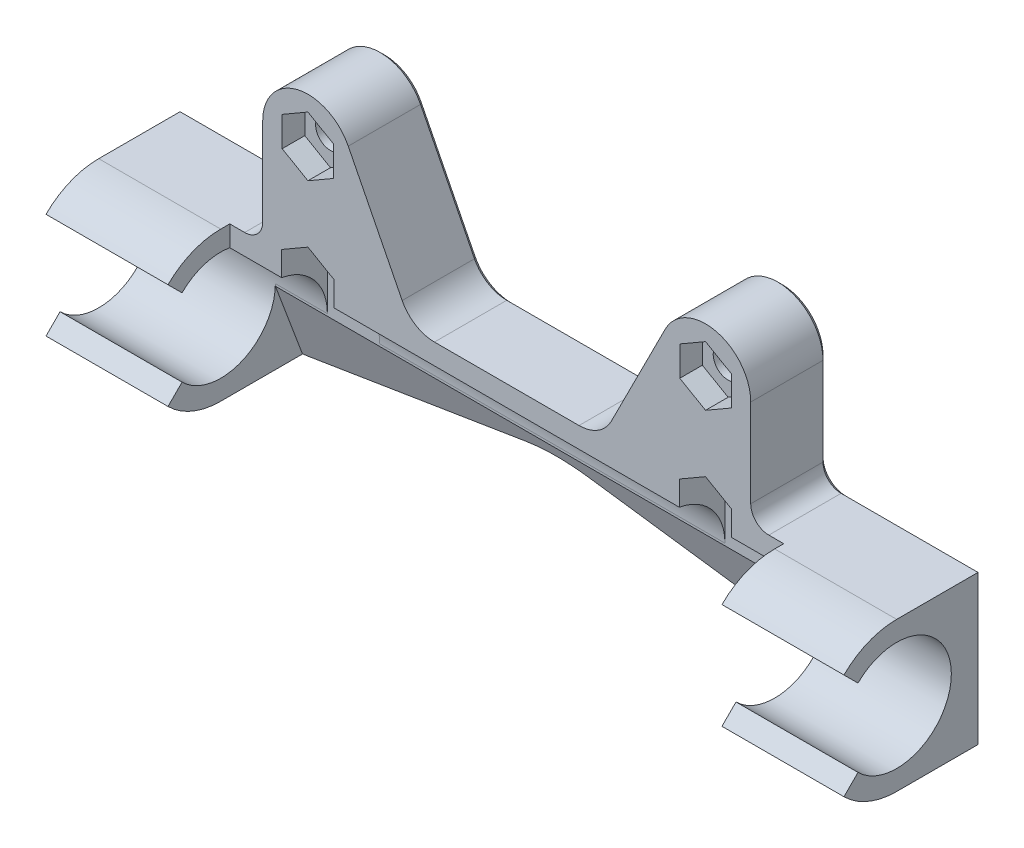
from build123d import *

# Parameters (mm, degrees)
BOSS_EXTRUDE1_DEPTH = 88.3
SKETCH6_R           = 1.65
BOSS_EXTRUDE2_DEPTH = 8.5
CUT_EXTRUDE1_DEPTH  = 93.261259475
SKETCH8_W           = 61.3
SKETCH8_H           = 21.483950942
CUT_EXTRUDE2_DEPTH  = 93.163658782
SKETCH9_W           = 61.3
SKETCH9_H           = 11.699409457
CUT_EXTRUDE3_DEPTH  = 93.53707735
SKETCH10_R          = 1.65
CUT_EXTRUDE4_DEPTH  = 94.043055829
CHAMFER1_SIZE       = 8
CHAMFER1_SIZE2      = 3
CUT_EXTRUDE5_DEPTH  = 93.537077445
FILLET1_R           = 2
CUT_EXTRUDE7_START  = -5.05
CUT_EXTRUDE7_DEPTH  = 5.05
CUT_EXTRUDE8_DEPTH  = 2.5
CHAMFER2_SIZE       = 0.5


with BuildPart() as part:
    # Sketch1 → Boss-Extrude1 (new body)
    with BuildSketch(Plane.ZY):
        with BuildLine():
            Line((-9.5, 8.25), (-9.5, -8.25))
            Line((-9.5, -8.25), (0, -8.25))
            ThreePointArc((0, -8.25), (8.25, 0), (0, 8.25))
            Line((0, 8.25), (-9.5, 8.25))
        make_face()
    extrude(amount=BOSS_EXTRUDE1_DEPTH)

    # Sketch6 → Boss-Extrude2 (add)
    with BuildSketch(Plane(origin=(0, 0, -9.5), x_dir=(-1, 0, 0), z_dir=(0, 0, -1))):
        with BuildLine():
            Line((17.15, -8.25), (17.15, 20))
            ThreePointArc((17.15, 20), (20.99096395, 24.863808737), (26.612654174, 22.254931867))
            Line((26.612654174, 22.254931867), (32.579554775, 10.446054507))
            ThreePointArc((32.579554775, 10.446054507), (34.053942202, 8.842964487), (36.149678114, 8.25))
            Line((36.149678114, 8.25), (52.150321886, 8.25))
            ThreePointArc((52.150321886, 8.25), (54.246057798, 8.842964487), (55.720445225, 10.446054507))
            Line((55.720445225, 10.446054507), (61.687345826, 22.254931867))
            ThreePointArc((61.687345826, 22.254931867), (67.30903605, 24.863808737), (71.15, 20))
            Line((71.15, 20), (71.15, -8.25))
            Line((71.15, -8.25), (17.15, -8.25))
        make_face()
        with Locations((22.15, 20)):
            Circle(SKETCH6_R, mode=Mode.SUBTRACT)
        with Locations(Location((66.15, 20, 0), (0, 0, 180))):
            Circle(SKETCH6_R, mode=Mode.SUBTRACT)
    extrude(amount=-BOSS_EXTRUDE2_DEPTH)

    # Sketch7 → Cut-Extrude1 (cut, through all)
    with BuildSketch(Plane.ZY.offset(88.3)):
        with BuildLine():
            Line((13.481907846, 13.481907846), (4.277996026, 4.277996026))
            ThreePointArc((4.277996026, 4.277996026), (-6.05, 0), (4.277996026, -4.277996026))
            Line((4.277996026, -4.277996026), (13.481907846, -13.481907846))
            Line((13.481907846, -13.481907846), (13.481907846, 13.481907846))
        make_face()
    extrude(amount=-CUT_EXTRUDE1_DEPTH, mode=Mode.SUBTRACT)

    # Sketch8 → Cut-Extrude2 (cut, through all)
    with BuildSketch(Plane.XY.offset(-1)):
        with Locations((-44.15, -2.491975471)):
            Rectangle(SKETCH8_W, SKETCH8_H)
    extrude(amount=CUT_EXTRUDE2_DEPTH, mode=Mode.SUBTRACT)

    # Sketch9 → Cut-Extrude3 (cut, through all)
    with BuildSketch(Plane(origin=(0, 0, -6.05), x_dir=(-1, 0, 0), z_dir=(0, 0, -1))):
        with Locations((44.15, -5.849704729)):
            Rectangle(SKETCH9_W, SKETCH9_H)
    extrude(amount=-CUT_EXTRUDE3_DEPTH, mode=Mode.SUBTRACT)

    # Sketch10 → Cut-Extrude4 (cut, through all)
    with BuildSketch(Plane(origin=(0, 0, -9.5), x_dir=(-1, 0, 0), z_dir=(0, 0, -1))):
        with Locations((22.15, 7)):
            Circle(SKETCH10_R)
        with Locations((66.15, 7)):
            Circle(SKETCH10_R)
    extrude(amount=-CUT_EXTRUDE4_DEPTH, mode=Mode.SUBTRACT)

    # Chamfer1
    chamfer1_edges = [part.edges().sort_by_distance(p)[0] for p in [
        (-44.15, -8.25, -6.05),
    ]]
    chamfer1_side = [part.faces().sort_by_distance(p)[0] for p in [
        (-44.15, -4.125, -6.05),
    ]]
    chamfer(chamfer1_edges, length=CHAMFER1_SIZE, length2=CHAMFER1_SIZE2, reference=chamfer1_side[0])

    # Sketch11 → Cut-Extrude5 (cut, through all)
    with BuildSketch(Plane(origin=(0, 0, -6.05), x_dir=(-1, 0, 0), z_dir=(0, 0, -1))):
        with BuildLine():
            Line((74.8, -8.25), (47.5958626, -1.828822614))
            ThreePointArc((47.5958626, -1.828822614), (44.15, -1.427659244), (40.7041374, -1.828822614))
            Line((40.7041374, -1.828822614), (13.5, -8.25))
            Line((13.5, -8.25), (13.5, -16.427659244))
            Line((13.5, -16.427659244), (74.8, -16.427659244))
            Line((74.8, -16.427659244), (74.8, -8.25))
        make_face()
    extrude(amount=CUT_EXTRUDE5_DEPTH, mode=Mode.SUBTRACT)

    # Fillet1
    fillet1_edges = [part.edges().sort_by_distance(p)[0] for p in [
        (-17.15, 8.25, -5.25),
        (-71.15, 8.25, -5.25),
    ]]
    fillet(fillet1_edges, radius=FILLET1_R)

    # Sketch13 → Cut-Extrude7 (cut)
    with BuildSketch(Plane.XY.offset(-1).offset(CUT_EXTRUDE7_START)):
        Polygon((-69.05, -2.12397244), (-63.25, -2.12397244), (-63.25, 8.674315781), (-66.15, 10.348631561), (-69.05, 8.674315781), align=None)
        Polygon((-25.05, -2.12397244), (-19.25, -2.12397244), (-19.25, 8.674315781), (-22.15, 10.348631561), (-25.05, 8.674315781), align=None)
    extrude(amount=CUT_EXTRUDE7_DEPTH, mode=Mode.SUBTRACT)

    # Sketch14 → Cut-Extrude8 (cut)
    with BuildSketch(Plane.XY.offset(-1)):
        Polygon((-69, 21.645448267), (-69, 18.354551733), (-66.15, 16.709103466), (-63.3, 18.354551733), (-63.3, 21.645448267), (-66.15, 23.290896534), align=None)
        Polygon((-22.15, 23.290896534), (-25, 21.645448267), (-25, 18.354551733), (-22.15, 16.709103466), (-19.3, 18.354551733), (-19.3, 21.645448267), align=None)
    extrude(amount=-CUT_EXTRUDE8_DEPTH, mode=Mode.SUBTRACT)

    # Chamfer2
    # the kernel refuses this chamfer: 0.5 mm, written as the material it takes off along each edge
    with BuildSketch(Plane(origin=(-88.3, 9.535841494, -9.5), x_dir=(0.9996219169112968, 0, -0.02749587661058574), z_dir=(0, -1, 0))) as chamfer2_piece_1:
        Polygon((CHAMFER2_SIZE * 0.999621916911, CHAMFER2_SIZE * 0.0274958766106), (-CHAMFER2_SIZE * 0.0274958766106, CHAMFER2_SIZE * 0.999621916911), (0, 0), align=None)
    extrude(amount=19.071682988, mode=Mode.SUBTRACT)
    with BuildSketch(Plane(origin=(-22.15, 7, -9.5), x_dir=(-1, 0, 0), z_dir=(0, -1, 0))) as chamfer2_piece_2:
        Polygon((1.65 + CHAMFER2_SIZE, 0), (1.65, -CHAMFER2_SIZE), (1.65, 0), align=None)
    revolve(axis=Axis((-22.15, 7, -9.5), (0, 0, -1)), mode=Mode.SUBTRACT)
    with BuildSketch(Plane(origin=(-66.15, 7, -9.5), x_dir=(-1, 0, 0), z_dir=(0, -1, 0))) as chamfer2_piece_3:
        Polygon((1.65 + CHAMFER2_SIZE, 0), (1.65, -CHAMFER2_SIZE), (1.65, 0), align=None)
    revolve(axis=Axis((-66.15, 7, -9.5), (0, 0, -1)), mode=Mode.SUBTRACT)
    with BuildSketch(Plane(origin=(-36.149678114, 8.25, -9.5), x_dir=(0, -0.9996219169112968, -0.027495876610585647), z_dir=(-1, 0, 0))) as chamfer2_piece_4:
        Polygon((CHAMFER2_SIZE * 0.999621916911, CHAMFER2_SIZE * 0.0274958766106), (-CHAMFER2_SIZE * 0.0274958766106, CHAMFER2_SIZE * 0.999621916911), (0, 0), align=None)
    extrude(amount=16.000643772, mode=Mode.SUBTRACT)
    with BuildSketch(Plane(origin=(1.285841494, -8.25, -9.5), x_dir=(0, 0.9996219169112968, -0.027495876610585647), z_dir=(-1, 0, 0)), Plane(origin=(-73.514158506, -8.25, -9.5), x_dir=(0, 0.9996219169112968, -0.027495876610585647), z_dir=(-1, 0, 0))) as chamfer2_piece_5:
        Polygon((CHAMFER2_SIZE * 0.999621916911, -CHAMFER2_SIZE * 0.0274958766106), (-CHAMFER2_SIZE * 0.0274958766106, -CHAMFER2_SIZE * 0.999621916911), (0, 0), align=None)
    extrude(amount=16.071682988, mode=Mode.SUBTRACT)
    with BuildSketch(Plane(origin=(-76.05145266, -8.545388874, -9.5), x_dir=(-0.22963731849575525, 0.9728878037695274, -0.027495876610585463), z_dir=(0.9732557753191584, 0.22972417332075415, 0)), Plane(origin=(-40.7041374, -1.828822614, -9.5), x_dir=(0.22963731849575528, 0.9728878037695274, -0.027495876610585706), z_dir=(0.9732557753191584, -0.2297241733207542, 0))) as chamfer2_piece_6:
        Polygon((CHAMFER2_SIZE * 0.999621916911, CHAMFER2_SIZE * 0.0274958766106), (-CHAMFER2_SIZE * 0.0274958766106, CHAMFER2_SIZE * 0.999621916911), (0, 0), align=None)
    extrude(amount=29.237524998, mode=Mode.SUBTRACT)
    with BuildSketch(Plane(origin=(-44.15, -16.427659244, -9.5), x_dir=(0.22972417332075398, 0.9732557753191584, 0), z_dir=(0.9732557753191584, -0.22972417332075398, 0))) as chamfer2_piece_7:
        Polygon((15 + CHAMFER2_SIZE, 0), (15, CHAMFER2_SIZE), (15, 0), align=None)
    revolve(axis=Axis((-44.15, -16.427659244, -9.5), (0, 0, 1)), revolution_arc=26.561666454, mode=Mode.SUBTRACT)
    with BuildSketch(Plane(origin=(-71.15, 20, -9.5), x_dir=(0.9996219169112968, 0, -0.02749587661058574), z_dir=(0, -1, 0)), Plane(origin=(-17.15, 10.25, -9.5), x_dir=(-0.9996219169112968, 0, -0.02749587661058555), z_dir=(0, 1, 0))) as chamfer2_piece_8:
        Polygon((CHAMFER2_SIZE * 0.999621916911, CHAMFER2_SIZE * 0.0274958766106), (-CHAMFER2_SIZE * 0.0274958766106, CHAMFER2_SIZE * 0.999621916911), (0, 0), align=None)
    extrude(amount=9.75, mode=Mode.SUBTRACT)
    with BuildSketch(Plane(origin=(1.285841494, 8.25, -9.5), x_dir=(0, -0.9996219169112968, -0.027495876610585647), z_dir=(-1, 0, 0))) as chamfer2_piece_9:
        Polygon((CHAMFER2_SIZE * 0.999621916911, CHAMFER2_SIZE * 0.0274958766106), (-CHAMFER2_SIZE * 0.0274958766106, CHAMFER2_SIZE * 0.999621916911), (0, 0), align=None)
    extrude(amount=16.435841494, mode=Mode.SUBTRACT)
    with BuildSketch(Plane(origin=(-73.15, 10.25, -9.5), x_dir=(0, -1, 0), z_dir=(-1, 0, 0))) as chamfer2_piece_10:
        Polygon((2, CHAMFER2_SIZE), (2 + CHAMFER2_SIZE, 0), (2, 0), align=None)
    revolve(axis=Axis((-73.15, 10.25, -9.5), (0, 0, 1)), revolution_arc=90, mode=Mode.SUBTRACT)
    with BuildSketch(Plane(origin=(-15.15, 10.25, -9.5), x_dir=(-1, 0, 0), z_dir=(0, 1, 0))) as chamfer2_piece_11:
        Polygon((2 + CHAMFER2_SIZE, 0), (2, CHAMFER2_SIZE), (2, 0), align=None)
    revolve(axis=Axis((-15.15, 10.25, -9.5), (0, 0, 1)), revolution_arc=90, mode=Mode.SUBTRACT)
    with BuildSketch(Plane(origin=(-36.149678114, 12.25, -9.5), x_dir=(0.8925308347817242, -0.45098637336824104, 0), z_dir=(0.45098637336824104, 0.8925308347817242, 0))) as chamfer2_piece_12:
        Polygon((4 + CHAMFER2_SIZE, 0), (4, -CHAMFER2_SIZE), (4, 0), align=None)
    revolve(axis=Axis((-36.149678114, 12.25, -9.5), (0, 0, -1)), revolution_arc=63.19301373, mode=Mode.SUBTRACT)
    with BuildSketch(Plane(origin=(-26.612654174, 22.254931867, -9.5), x_dir=(0.8921933839669467, -0.4508158630472358, -0.027495876610585532), z_dir=(-0.45098637336824193, -0.8925308347817238, 0)), Plane(origin=(-55.720445225, 10.446054507, -9.5), x_dir=(-0.8921933839669467, -0.4508158630472356, -0.027495876610585574), z_dir=(-0.45098637336824177, 0.8925308347817239, 0))) as chamfer2_piece_13:
        Polygon((CHAMFER2_SIZE * 0.999621916911, CHAMFER2_SIZE * 0.0274958766106), (-CHAMFER2_SIZE * 0.0274958766106, CHAMFER2_SIZE * 0.999621916911), (0, 0), align=None)
    extrude(amount=13.23077803, mode=Mode.SUBTRACT)
    with BuildSketch(Plane(origin=(-22.15, 20, -9.5), x_dir=(1, 0, 0), z_dir=(0, -1, 0))) as chamfer2_piece_14:
        Polygon((5 - CHAMFER2_SIZE, 0), (5, CHAMFER2_SIZE), (5, 0), align=None)
    revolve(axis=Axis((-22.15, 20, -9.5), (0, 0, 1)), revolution_arc=153.19301373, mode=Mode.SUBTRACT)
    with BuildSketch(Plane(origin=(-52.150321886, 12.25, -9.5), x_dir=(0, -1, 0), z_dir=(1, 0, 0))) as chamfer2_piece_15:
        Polygon((4 + CHAMFER2_SIZE, 0), (4, -CHAMFER2_SIZE), (4, 0), align=None)
    revolve(axis=Axis((-52.150321886, 12.25, -9.5), (0, 0, -1)), revolution_arc=63.19301373, mode=Mode.SUBTRACT)
    with BuildSketch(Plane(origin=(-66.15, 20, -9.5), x_dir=(0.892530834781725, 0.45098637336823943, 0), z_dir=(0.45098637336823943, -0.892530834781725, 0))) as chamfer2_piece_16:
        Polygon((5 - CHAMFER2_SIZE, 0), (5, CHAMFER2_SIZE), (5, 0), align=None)
    revolve(axis=Axis((-66.15, 20, -9.5), (0, 0, 1)), revolution_arc=153.19301373, mode=Mode.SUBTRACT)
    with BuildSketch(Plane(origin=(-22.15, 20, -9.5), x_dir=(-1, 0, 0), z_dir=(0, -1, 0))) as chamfer2_piece_17:
        Polygon((1.65 + CHAMFER2_SIZE, 0), (1.65, -CHAMFER2_SIZE), (1.65, 0), align=None)
    revolve(axis=Axis((-22.15, 20, -9.5), (0, 0, -1)), mode=Mode.SUBTRACT)
    with BuildSketch(Plane(origin=(-66.15, 20, -9.5), x_dir=(1, 0, 0), z_dir=(0, 1, 0))) as chamfer2_piece_18:
        Polygon((1.65 + CHAMFER2_SIZE, 0), (1.65, -CHAMFER2_SIZE), (1.65, 0), align=None)
    revolve(axis=Axis((-66.15, 20, -9.5), (0, 0, -1)), mode=Mode.SUBTRACT)
    with BuildSketch(Plane(origin=(0, 9.535841494, -9.5), x_dir=(-0.9996219169112968, 0, -0.02749587661058563), z_dir=(0, -1, 0))) as chamfer2_piece_19:
        Polygon((CHAMFER2_SIZE * 0.999621916911, -CHAMFER2_SIZE * 0.0274958766106), (-CHAMFER2_SIZE * 0.0274958766106, -CHAMFER2_SIZE * 0.999621916911), (0, 0), align=None)
    extrude(amount=19.071682988, mode=Mode.SUBTRACT)
    with BuildSketch(Plane(origin=(-73.15, 8.25, -9.5), x_dir=(0, 0.027495876610585647, 0.9996219169112968), z_dir=(-1, 0, 0))) as chamfer2_piece_20:
        Polygon((CHAMFER2_SIZE * 0.999621916911, -CHAMFER2_SIZE * 0.0274958766106), (-CHAMFER2_SIZE * 0.0274958766106, -CHAMFER2_SIZE * 0.999621916911), (0, 0), align=None)
    extrude(amount=16.435841494, mode=Mode.SUBTRACT)


solid = part.part
